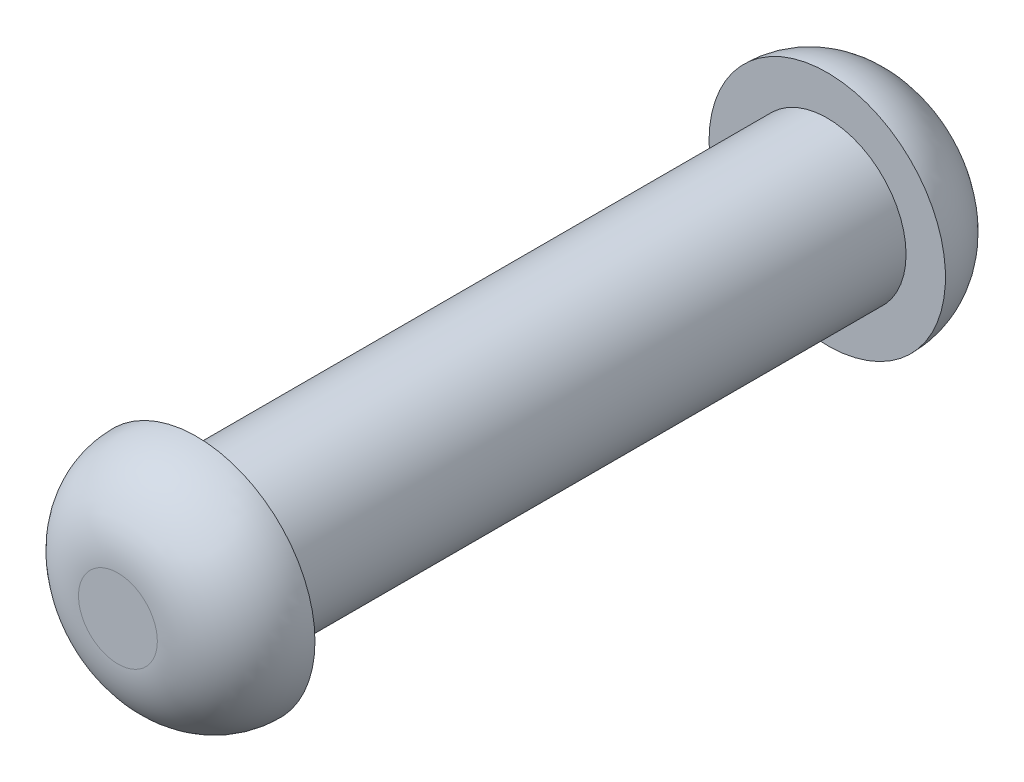
from build123d import *

# Parameters (mm, degrees)
IZIM1_R                     = 5
Y_KSEKLIK_EKSTR_ZYON1_DEPTH = 40
IZIM2_R                     = 7.5
Y_KSEKLIK_EKSTR_ZYON2_DEPTH = 5
RADYUS1_R                   = 5
Y_KSEKLIK_EKSTR_ZYON3_START = 5
IZIM3_R                     = 7.5
Y_KSEKLIK_EKSTR_ZYON3_DEPTH = 5
RADYUS2_R                   = 5


with BuildPart() as part:
    # Çizim1 → Yükseklik-Ekstrüzyon1 (new body)
    with BuildSketch(Plane.XY):
        Circle(IZIM1_R)
    extrude(amount=Y_KSEKLIK_EKSTR_ZYON1_DEPTH)

    # Çizim2 → Yükseklik-Ekstrüzyon2 (add)
    with BuildSketch(Plane.XY.offset(40)):
        Circle(IZIM2_R)
    extrude(amount=Y_KSEKLIK_EKSTR_ZYON2_DEPTH)

    # Radyus1
    radyus1_edges = [part.edges().sort_by_distance(p)[0] for p in [
        (-7.5, 0, 45),
    ]]
    fillet(radyus1_edges, radius=RADYUS1_R - 0.0001)  # a hair under: the kernel refuses the full size

    # Çizim3 → Yükseklik-Ekstrüzyon3 (add)
    with BuildSketch(Plane(origin=(0, 0, 0), x_dir=(-1, 0, 0), z_dir=(0, 0, -1)).offset(Y_KSEKLIK_EKSTR_ZYON3_START)):
        Circle(IZIM3_R)
    extrude(amount=-Y_KSEKLIK_EKSTR_ZYON3_DEPTH)

    # Radyus2
    radyus2_edges = [part.edges().sort_by_distance(p)[0] for p in [
        (7.5, 0, -5),
    ]]
    fillet(radyus2_edges, radius=RADYUS2_R - 0.0001)  # a hair under: the kernel refuses the full size


solid = part.part
